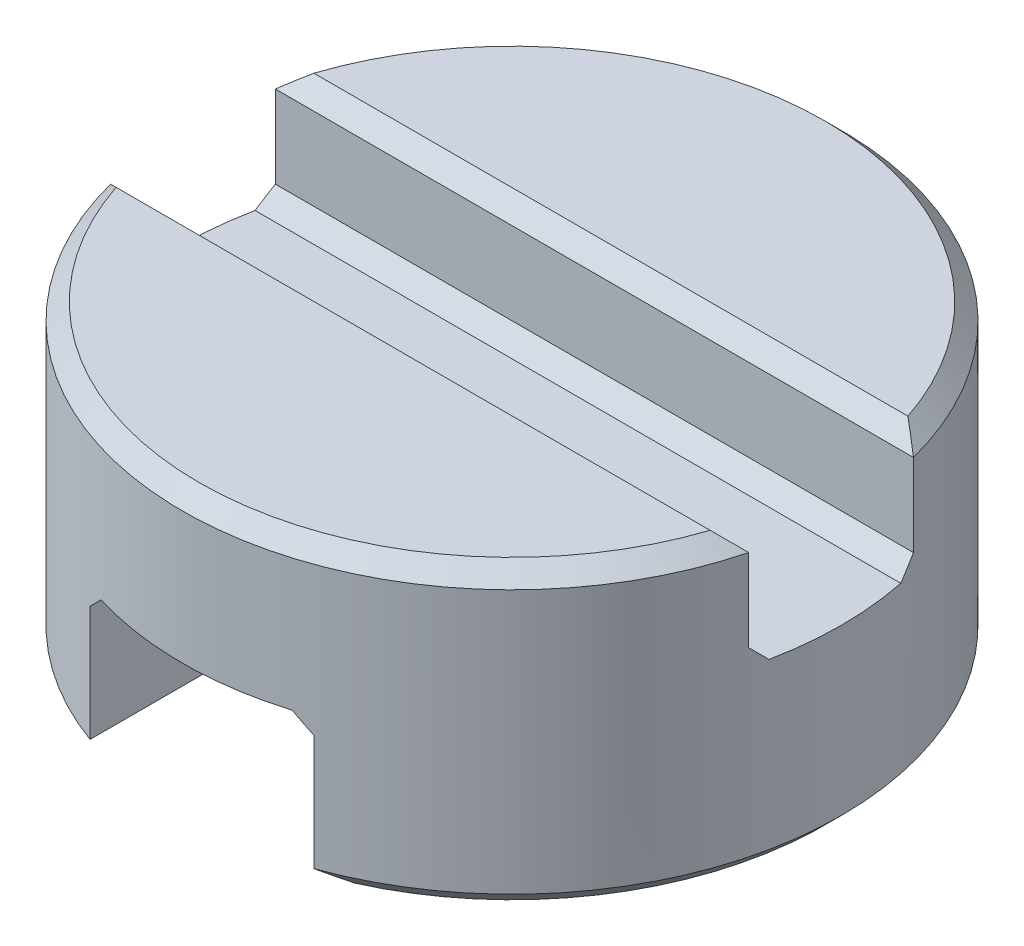
from build123d import *

# Parameters (mm, degrees)
SKETCH_1_R          = 10
EXTRUDE_1_DEPTH     = 9
SKETCH_2_W          = 6.8
SKETCH_2_H          = 20
CUT_EXTRUDE_1_DEPTH = 4.5
CHAMFER_1_SIZE      = 0.5
SKETCH_3_W          = 22
SKETCH_3_H          = 5
CUT_EXTRUDE_2_DEPTH = 3.5
CHAMFER_2_SIZE      = 0.5


with BuildPart() as part:
    # Эскиз1 → Бобышка-Вытянуть1 (new body)
    with BuildSketch(Plane(origin=(0, 0, 0), x_dir=(1, 0, 0), z_dir=(0, 1, 0))):
        Circle(SKETCH_1_R)
    extrude(amount=EXTRUDE_1_DEPTH)

    # Эскиз2 → Вырез-Вытянуть1 (cut)
    with BuildSketch(Plane.XZ):
        Rectangle(SKETCH_2_W, SKETCH_2_H)
    extrude(amount=-CUT_EXTRUDE_1_DEPTH, mode=Mode.SUBTRACT)

    # Фаска1
    chamfer_1_edges = [part.edges().sort_by_distance(p)[0] for p in [
        (-10, 0, 0),
        (-3.4, 0, 0),
        (8.185352772, 0, 5.744562647),
        (3.4, 0, 0),
        (-3.4, 4.5, 0),
        (3.4, 4.5, 0),
    ]]
    chamfer(chamfer_1_edges, length=CHAMFER_1_SIZE)

    # Эскиз3 → Вырез-Вытянуть2 (cut)
    with BuildSketch(Plane(origin=(0, 9, 0), x_dir=(1, 0, 0), z_dir=(0, 1, 0))):
        Rectangle(SKETCH_3_W, SKETCH_3_H)
    extrude(amount=-CUT_EXTRUDE_2_DEPTH, mode=Mode.SUBTRACT)

    # Фаска2
    chamfer_2_edges = [part.edges().sort_by_distance(p)[0] for p in [
        (0, 9, 10),
        (0, 9, 2.5),
        (0, 9, -10),
        (0, 9, -2.5),
        (0, 5.5, 2.5),
        (0, 5.5, -2.5),
    ]]
    chamfer(chamfer_2_edges, length=CHAMFER_2_SIZE)


solid = part.part
